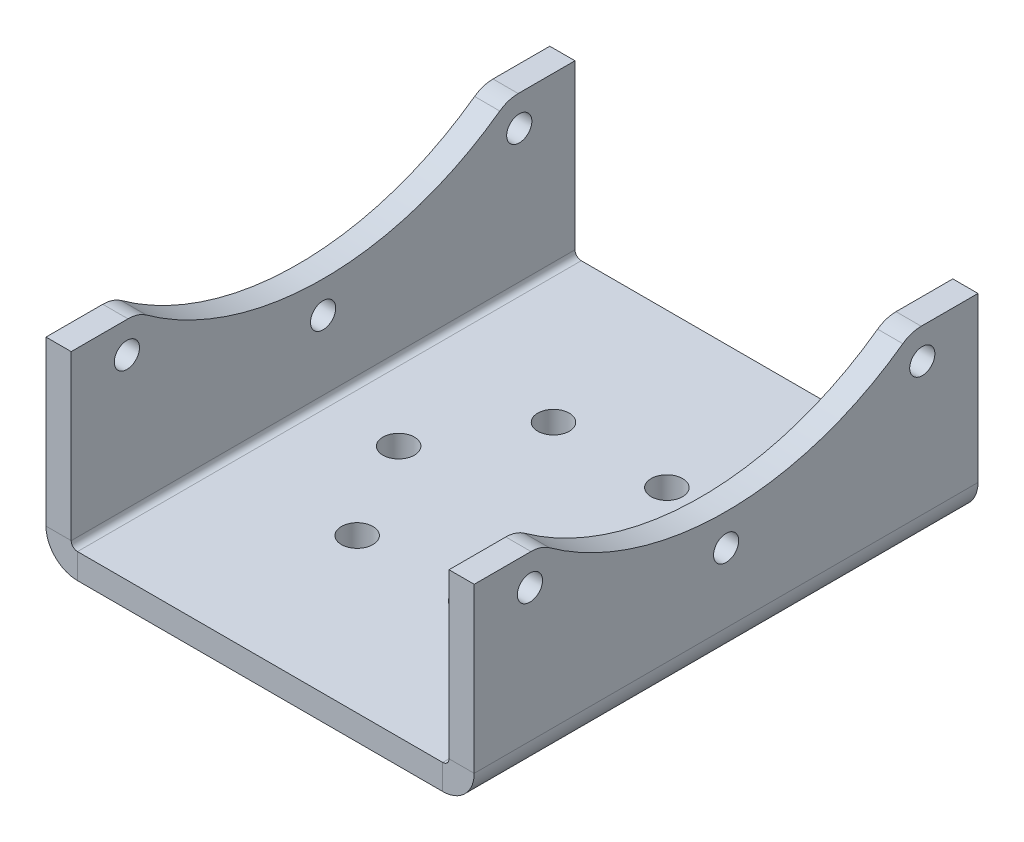
from build123d import *

# Parameters (mm, degrees)
SM_BASE_FLANGE_1_DEPTH   = 80
CUT_EXTRUDE_3_DEPTH      = 109.411254028
CUT_EXTRUDE_3_DEPTH_BACK = 109.411254028
SKETCH_6_R               = 48
SKETCH_6_R_2             = 2
FILLET_1_R               = 5
SKETCH_9_R               = 2.5
CUT_EXTRUDE_4_DEPTH      = 93.287593966


# Sheet-metal steps are written as plain solids
with BuildPart() as part:
    # Sketch 1 → Базовая кромка1 (new body)
    with BuildSketch(Plane.XY):
        with BuildLine():
            Line((-30, 27), (-30, 1))
            ThreePointArc((-30, 1), (-29.707106781, 0.292893219), (-29, 0))
            Line((-29, 0), (29, 0))
            ThreePointArc((29, 0), (29.707106781, 0.292893219), (30, 1))
            Line((30, 1), (30, 27))
            Line((30, 27), (34, 27))
            Line((34, 27), (34, 1))
            ThreePointArc((34, 1), (32.535533906, -2.535533906), (29, -4))
            Line((29, -4), (-29, -4))
            ThreePointArc((-29, -4), (-32.535533906, -2.535533906), (-34, 1))
            Line((-34, 1), (-34, 27))
            Line((-34, 27), (-30, 27))
        make_face()
    extrude(amount=SM_BASE_FLANGE_1_DEPTH)

    # Эскиз6 → Вырез-Вытянуть3 (cut, two sides: drawn at the far end of the back side and taken through both)
    with BuildSketch(Plane.ZY.offset(34).offset(-CUT_EXTRUDE_3_DEPTH_BACK)):
        with Locations((40, 65)):
            Circle(SKETCH_6_R)
        with Locations((40, 12)):
            Circle(SKETCH_6_R_2)
        with Locations((8.847381628, 22.122099298)):
            Circle(SKETCH_6_R_2)
        with Locations((71.152618372, 22.122099298)):
            Circle(SKETCH_6_R_2)
    extrude(amount=CUT_EXTRUDE_3_DEPTH + CUT_EXTRUDE_3_DEPTH_BACK, mode=Mode.SUBTRACT)

    # Скругление1
    fillet_1_edges = [part.edges().sort_by_distance(p)[0] for p in [
        (32, 27, 10.674243403),
        (32, 27, 69.325756597),
        (-32, 27, 10.674243403),
        (-32, 27, 69.325756597),
    ]]
    fillet(fillet_1_edges, radius=FILLET_1_R)

    # Эскиз9 → Вырез-Вытянуть4 (cut, through all)
    with BuildSketch(Plane.XZ.offset(4)):
        with Locations((-18, 40)):
            Circle(SKETCH_9_R)
        with Locations((-9, 55.588457268)):
            Circle(SKETCH_9_R)
        with Locations((9, 55.588457268)):
            Circle(SKETCH_9_R)
        with Locations((18, 40)):
            Circle(SKETCH_9_R)
        with Locations((9, 24.411542732)):
            Circle(SKETCH_9_R)
        with Locations((-9, 24.411542732)):
            Circle(SKETCH_9_R)
    extrude(amount=-CUT_EXTRUDE_4_DEPTH, mode=Mode.SUBTRACT)


solid = part.part
